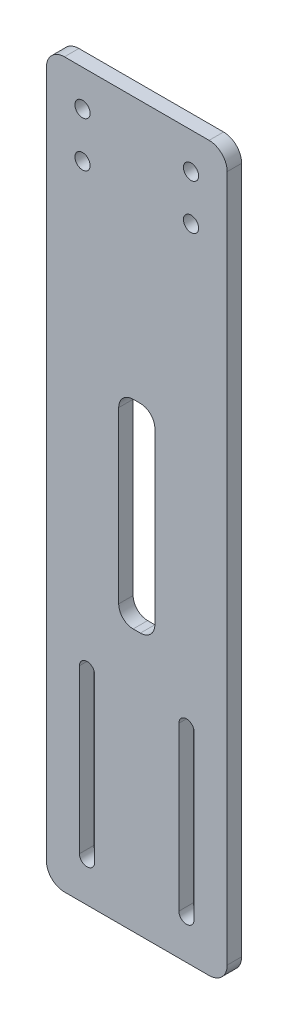
from build123d import *

# Parameters (mm, degrees)
SKETCH1_R          = 4.2
BASE_FLANGE1_DEPTH = 8


# Sheet-metal steps are written as plain solids
with BuildPart() as part:
    # Sketch1 → Base-Flange1 (new body)
    with BuildSketch(Plane.XY):
        with BuildLine():
            Line((-40, 200), (40, 200))
            ThreePointArc((40, 200), (47.071067812, 197.071067812), (50, 190))
            Line((50, 190), (50, -190))
            ThreePointArc((50, -190), (47.071067812, -197.071067812), (40, -200))
            Line((40, -200), (-40, -200))
            ThreePointArc((-40, -200), (-47.071067812, -197.071067812), (-50, -190))
            Line((-50, -190), (-50, 190))
            ThreePointArc((-50, 190), (-47.071067812, 197.071067812), (-40, 200))
        make_face()
        with Locations((30, 180)):
            Circle(SKETCH1_R, mode=Mode.SUBTRACT)
        with Locations((30, 155)):
            Circle(SKETCH1_R, mode=Mode.SUBTRACT)
        with Locations((-30, 180)):
            Circle(SKETCH1_R, mode=Mode.SUBTRACT)
        with Locations((-30, 155)):
            Circle(SKETCH1_R, mode=Mode.SUBTRACT)
        with BuildLine():
            Line((23.3, -87.5), (23.3, -177.5))
            ThreePointArc((23.3, -177.5), (27.5, -181.7), (31.7, -177.5))
            Line((31.7, -177.5), (31.7, -87.5))
            ThreePointArc((31.7, -87.5), (27.5, -83.3), (23.3, -87.5))
        make_face(mode=Mode.SUBTRACT)
        with BuildLine():
            Line((-23.3, -177.5), (-23.3, -87.5))
            ThreePointArc((-23.3, -87.5), (-27.5, -83.3), (-31.7, -87.5))
            Line((-31.7, -87.5), (-31.7, -177.5))
            ThreePointArc((-31.7, -177.5), (-27.5, -181.7), (-23.3, -177.5))
        make_face(mode=Mode.SUBTRACT)
        with BuildLine():
            Line((-2, -55), (2, -55))
            ThreePointArc((2, -55), (7.656854249, -52.656854249), (10, -47))
            Line((10, -47), (10, 47))
            ThreePointArc((10, 47), (7.656854249, 52.656854249), (2, 55))
            Line((2, 55), (-2, 55))
            ThreePointArc((-2, 55), (-7.656854249, 52.656854249), (-10, 47))
            Line((-10, 47), (-10, -47))
            ThreePointArc((-10, -47), (-7.656854249, -52.656854249), (-2, -55))
        make_face(mode=Mode.SUBTRACT)
    extrude(amount=-BASE_FLANGE1_DEPTH)


solid = part.part
